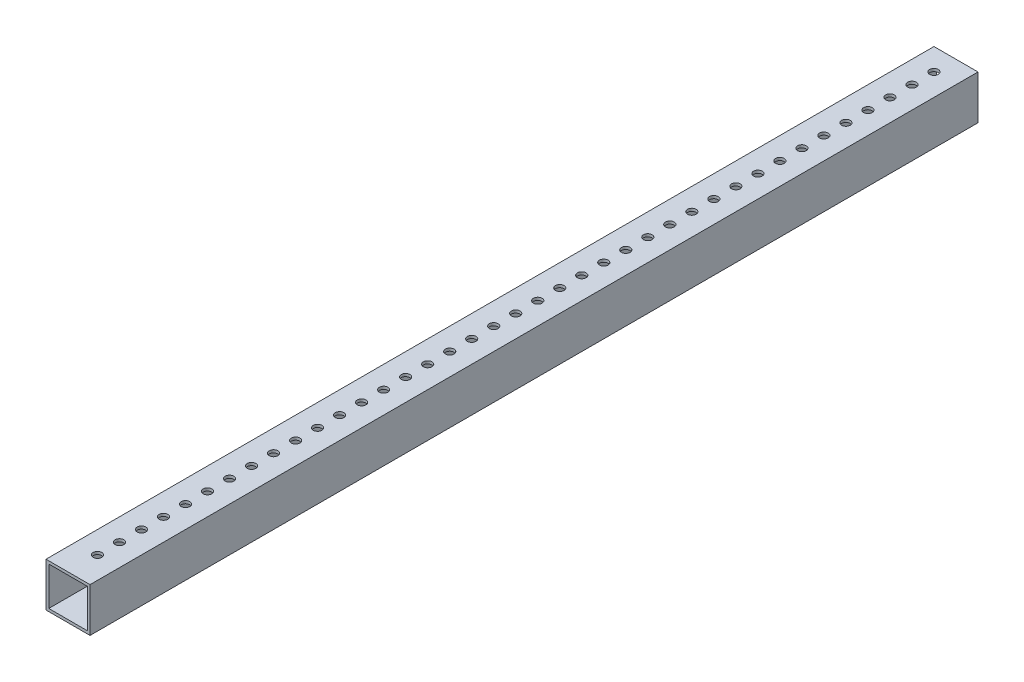
from build123d import *

# Parameters (mm, degrees)
SKETCH1_W               = 25.4
SKETCH1_H               = 25.4
BOSS_EXTRUDE1_DEPTH     = 256.145698528
SHELL1_T                = -1.5875
CUT_EXTRUDE1_DEPTH      = 257.774607145
CUT_EXTRUDE1_DEPTH_BACK = 257.774607145
SKETCH3_R               = 2.4892


with BuildPart() as part:
    # Sketch1 → Boss-Extrude1 (new, symmetric)
    with BuildSketch(Plane.XY):
        Rectangle(SKETCH1_W, SKETCH1_H)
    extrude(amount=BOSS_EXTRUDE1_DEPTH, both=True)

    # Shell1
    shell1_openings = [part.faces().sort_by_distance(p)[0] for p in [
        (0, 0, -256.145698528),
        (0, 0, 256.145698528),
    ]]
    offset(amount=SHELL1_T, openings=shell1_openings, kind=Kind.INTERSECTION)

    # Sketch3 → Cut-Extrude1 (cut, two sides: drawn at the far end of the back side and taken through both)
    with BuildSketch(Plane(origin=(0, 0, 0), x_dir=(1, 0, 0), z_dir=(0, 1, 0)).offset(-CUT_EXTRUDE1_DEPTH_BACK)):
        with Locations((0, 243.445698528)):
            Circle(SKETCH3_R)
        with Locations((0, 230.745698528)):
            Circle(SKETCH3_R)
        with Locations((0, 218.045698528)):
            Circle(SKETCH3_R)
        with Locations((0, 205.345698528)):
            Circle(SKETCH3_R)
        with Locations((0, 192.645698528)):
            Circle(SKETCH3_R)
        with Locations((0, 179.945698528)):
            Circle(SKETCH3_R)
        with Locations((0, 167.245698528)):
            Circle(SKETCH3_R)
        with Locations((0, 154.545698528)):
            Circle(SKETCH3_R)
        with Locations((0, 141.845698528)):
            Circle(SKETCH3_R)
        with Locations((0, 129.145698528)):
            Circle(SKETCH3_R)
        with Locations((0, 116.445698528)):
            Circle(SKETCH3_R)
        with Locations((0, 103.745698528)):
            Circle(SKETCH3_R)
        with Locations((0, 91.045698528)):
            Circle(SKETCH3_R)
        with Locations((0, 78.345698528)):
            Circle(SKETCH3_R)
        with Locations((0, 65.645698528)):
            Circle(SKETCH3_R)
        with Locations((0, 52.945698528)):
            Circle(SKETCH3_R)
        with Locations((0, 40.245698528)):
            Circle(SKETCH3_R)
        with Locations((0, 27.545698528)):
            Circle(SKETCH3_R)
        with Locations((0, 14.845698528)):
            Circle(SKETCH3_R)
        with Locations((0, 2.145698528)):
            Circle(SKETCH3_R)
        with Locations((0, -10.554301472)):
            Circle(SKETCH3_R)
        with Locations((0, -23.254301472)):
            Circle(SKETCH3_R)
        with Locations((0, -35.954301472)):
            Circle(SKETCH3_R)
        with Locations((0, -48.654301472)):
            Circle(SKETCH3_R)
        with Locations((0, -61.354301472)):
            Circle(SKETCH3_R)
        with Locations((0, -74.054301472)):
            Circle(SKETCH3_R)
        with Locations((0, -86.754301472)):
            Circle(SKETCH3_R)
        with Locations((0, -99.454301472)):
            Circle(SKETCH3_R)
        with Locations((0, -112.154301472)):
            Circle(SKETCH3_R)
        with Locations((0, -124.854301472)):
            Circle(SKETCH3_R)
        with Locations((0, -137.554301472)):
            Circle(SKETCH3_R)
        with Locations((0, -150.254301472)):
            Circle(SKETCH3_R)
        with Locations((0, -162.954301472)):
            Circle(SKETCH3_R)
        with Locations((0, -175.654301472)):
            Circle(SKETCH3_R)
        with Locations((0, -188.354301472)):
            Circle(SKETCH3_R)
        with Locations((0, -201.054301472)):
            Circle(SKETCH3_R)
        with Locations((0, -213.754301472)):
            Circle(SKETCH3_R)
        with Locations((0, -226.454301472)):
            Circle(SKETCH3_R)
        with Locations((0, -239.154301472)):
            Circle(SKETCH3_R)
    extrude(amount=CUT_EXTRUDE1_DEPTH + CUT_EXTRUDE1_DEPTH_BACK, mode=Mode.SUBTRACT)


solid = part.part
